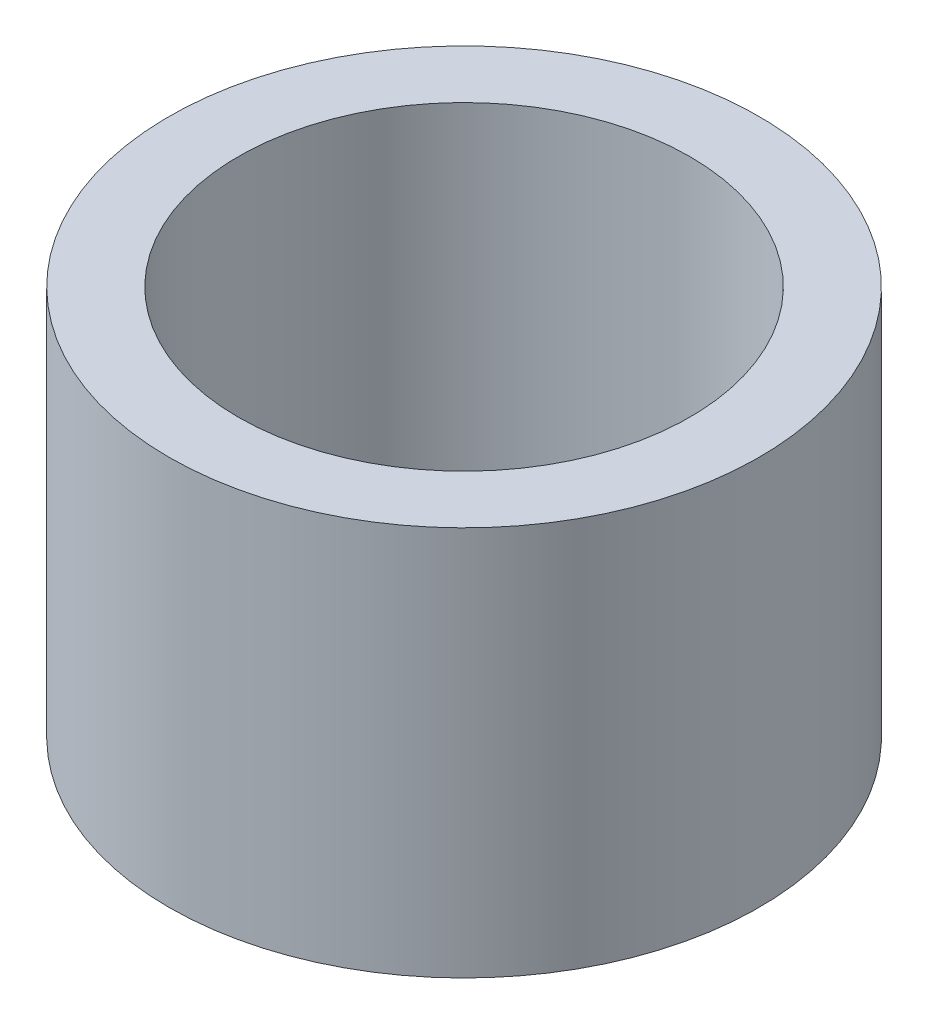
from build123d import *

# Parameters (mm, degrees)
SKETCH1_R           = 30
BOSS_EXTRUDE1_DEPTH = 39.631255513
SKETCH2_R           = 22.950882177
CUT_EXTRUDE1_DEPTH  = 59.057182274


with BuildPart() as part:
    # Sketch1 → Boss-Extrude1 (new body)
    with BuildSketch(Plane(origin=(0, 0, 0), x_dir=(1, 0, 0), z_dir=(0, 1, 0))):
        Circle(SKETCH1_R)
    extrude(amount=BOSS_EXTRUDE1_DEPTH)

    # Sketch2 → Cut-Extrude1 (cut, through all)
    with BuildSketch(Plane(origin=(0, 0, 0), x_dir=(1, 0, 0), z_dir=(0, 1, 0))):
        Circle(SKETCH2_R)
    extrude(amount=CUT_EXTRUDE1_DEPTH, mode=Mode.SUBTRACT)


solid = part.part
